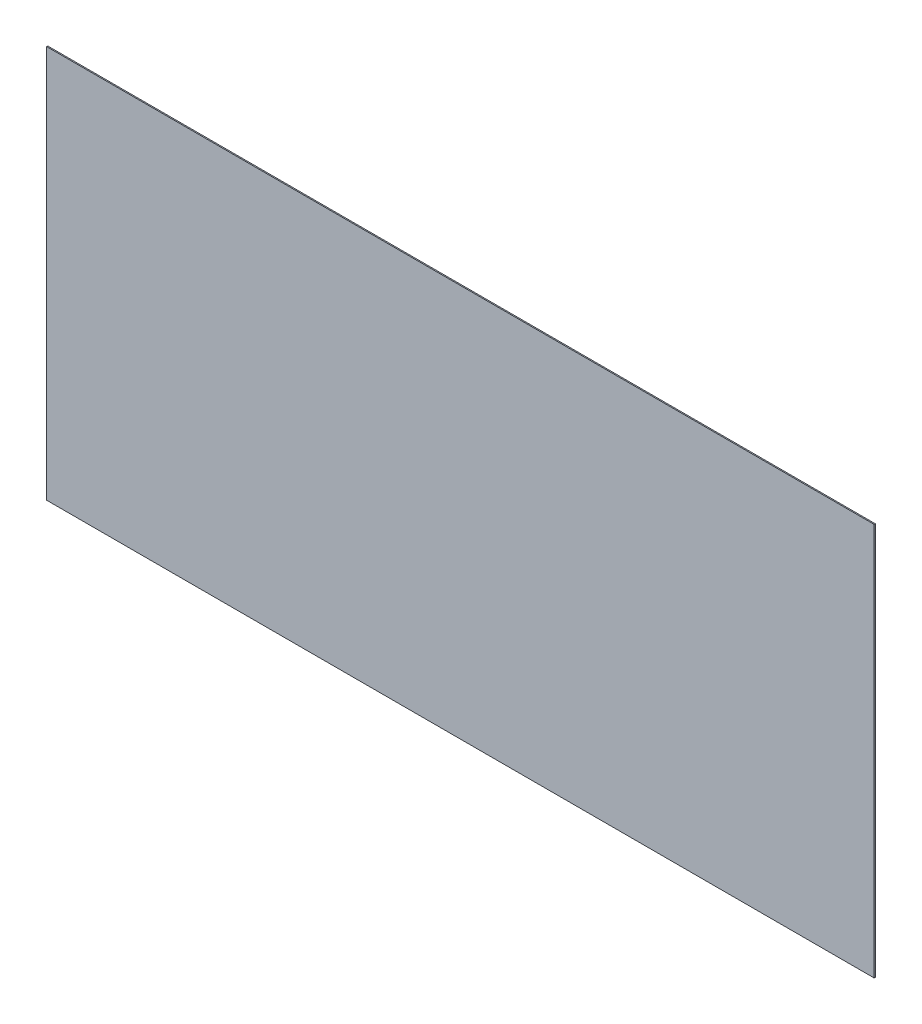
from build123d import *

# Parameters (mm, degrees)
SKETCH1_W             = 740
SKETCH1_H             = 351.34
BOTTOM_FIREWALL_DEPTH = 1


# Sheet-metal steps are written as plain solids
with BuildPart() as part:
    # Sketch1 → Bottom Firewall (new body)
    with BuildSketch(Plane.XY):
        Rectangle(SKETCH1_W, SKETCH1_H)
    extrude(amount=-BOTTOM_FIREWALL_DEPTH)


solid = part.part
